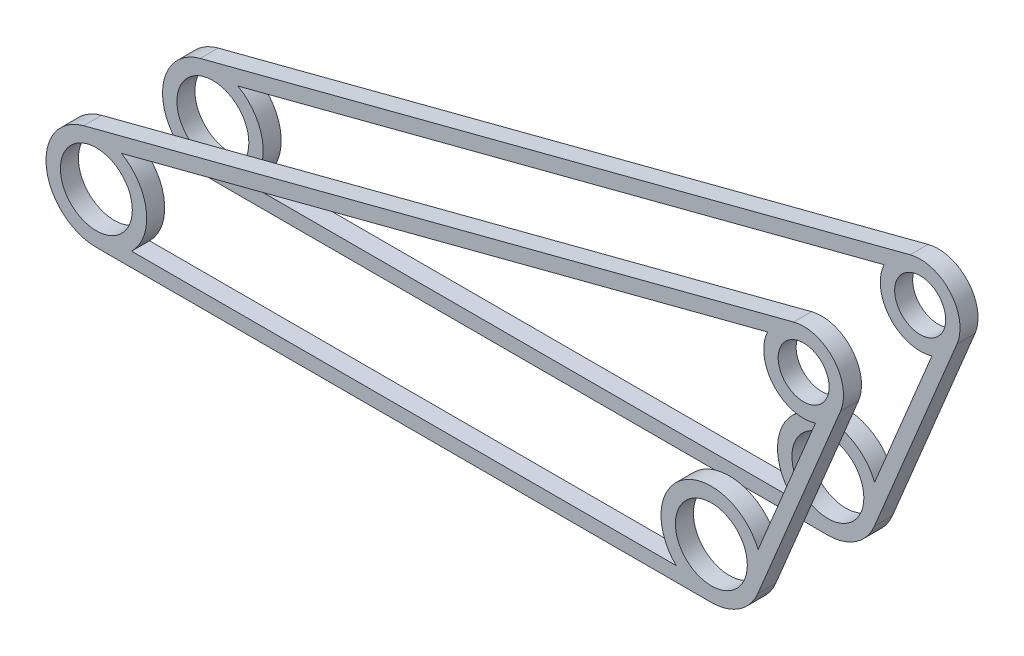
from build123d import *

# Parameters (mm, degrees)
BOSS_EXTRUDE1_START = 8.6995
SKETCH1_R           = 6.35
SKETCH1_R_2         = 4.5
BOSS_EXTRUDE1_DEPTH = 3.175
BOSS_EXTRUDE2_START = -8.6995
SKETCH1_4_R         = 6.35
SKETCH1_4_R_2       = 4.5
BOSS_EXTRUDE2_DEPTH = 3.175


with BuildPart() as part:
    # Sketch1 → Boss-Extrude1 (new body)
    with BuildSketch(Plane.XY.offset(BOSS_EXTRUDE1_START)):
        with BuildLine():
            ThreePointArc((-2.240939106, 8.602923452), (-8.817938804, -1.129626157), (0, -8.89))
            Line((0, -8.89), (108.585, -8.89))
            ThreePointArc((108.585, -8.89), (113.521814689, -7.3932375), (116.796258377, -3.406954044))
            Line((116.796258377, -3.406954044), (131.38026698, 31.742643294))
            ThreePointArc((131.38026698, 31.742643294), (130.188253202, 39.062333622), (123.103161211, 41.253277443))
            Line((123.103161211, 41.253277443), (-2.240939106, 8.602923452))
        make_face()
        Circle(SKETCH1_R, mode=Mode.SUBTRACT)
        with BuildLine():
            Line((4.420121426, 7.713275995), (118.50424059, 37.43056517))
            ThreePointArc((118.50424059, 37.43056517), (119.567273114, 29.81889368), (126.959354757, 27.715394219))
            Line((126.959354757, 27.715394219), (116.834555694, 3.31314516))
            ThreePointArc((116.834555694, 3.31314516), (103.648185311, 7.3932375), (102.363296053, -6.35))
            Line((102.363296053, -6.35), (6.221703947, -6.35))
            ThreePointArc((6.221703947, -6.35), (8.817938804, 1.129626157), (4.420121426, 7.713275995))
        make_face(mode=Mode.SUBTRACT)
        with Locations((124.877763158, 34.440613651)):
            Circle(SKETCH1_R_2, mode=Mode.SUBTRACT)
        with Locations((108.585, 0)):
            Circle(SKETCH1_R, mode=Mode.SUBTRACT)
    extrude(amount=BOSS_EXTRUDE1_DEPTH)


with BuildPart() as body_2:
    # Sketch1<4> → Boss-Extrude2 (new body)
    with BuildSketch(Plane.XY.offset(BOSS_EXTRUDE2_START)):
        with BuildLine():
            ThreePointArc((-2.240939106, 8.602923452), (-8.817938804, -1.129626157), (0, -8.89))
            Line((0, -8.89), (108.585, -8.89))
            ThreePointArc((108.585, -8.89), (113.521814689, -7.3932375), (116.796258377, -3.406954044))
            Line((116.796258377, -3.406954044), (131.38026698, 31.742643294))
            ThreePointArc((131.38026698, 31.742643294), (130.188253202, 39.062333622), (123.103161211, 41.253277443))
            Line((123.103161211, 41.253277443), (-2.240939106, 8.602923452))
        make_face()
        Circle(SKETCH1_4_R, mode=Mode.SUBTRACT)
        with BuildLine():
            Line((4.420121426, 7.713275995), (118.50424059, 37.43056517))
            ThreePointArc((118.50424059, 37.43056517), (119.567273114, 29.81889368), (126.959354757, 27.715394219))
            Line((126.959354757, 27.715394219), (116.834555694, 3.31314516))
            ThreePointArc((116.834555694, 3.31314516), (103.648185311, 7.3932375), (102.363296053, -6.35))
            Line((102.363296053, -6.35), (6.221703947, -6.35))
            ThreePointArc((6.221703947, -6.35), (8.817938804, 1.129626157), (4.420121426, 7.713275995))
        make_face(mode=Mode.SUBTRACT)
        with Locations((124.877763158, 34.440613651)):
            Circle(SKETCH1_4_R_2, mode=Mode.SUBTRACT)
        with Locations((108.585, 0)):
            Circle(SKETCH1_4_R, mode=Mode.SUBTRACT)
    extrude(amount=-BOSS_EXTRUDE2_DEPTH)


solid = Compound([part.part, body_2.part])
